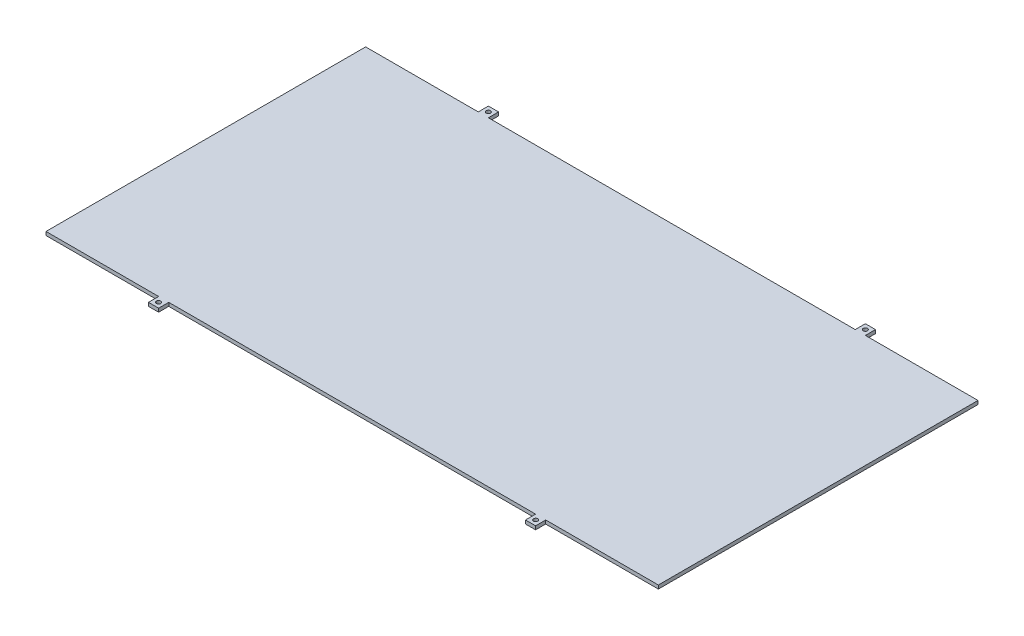
from build123d import *

# Parameters (mm, degrees)
SKETCH1_W           = 543.73
SKETCH1_H           = 3.175
BOSS_EXTRUDE1_DEPTH = 283.825
CUT_EXTRUDE1_DEPTH  = 1.3
SKETCH2_W           = 9
SKETCH2_H           = 9
SKETCH2_R           = 1.925
BOSS_EXTRUDE2_DEPTH = 3.125


with BuildPart() as part:
    # Sketch1 → Boss-Extrude1 (new body)
    with BuildSketch(Plane.XY):
        with Locations((-308.730031966, 1.266681686)):
            Rectangle(SKETCH1_W, SKETCH1_H)
    extrude(amount=BOSS_EXTRUDE1_DEPTH)

    # GasketGroove → Cut-Extrude1 (cut)
    with BuildSketch(Plane.XZ.offset(0.320818314)):
        with BuildLine():
            Line((-37.865031966, 2), (-37.865031966, 281.825))
            ThreePointArc((-37.865031966, 281.825), (-38.157925185, 282.532106781), (-38.865031966, 282.825))
            Line((-38.865031966, 282.825), (-578.595031966, 282.825))
            ThreePointArc((-578.595031966, 282.825), (-579.302138747, 282.532106781), (-579.595031966, 281.825))
            Line((-579.595031966, 281.825), (-579.595031966, 2))
            ThreePointArc((-579.595031966, 2), (-579.302138747, 1.292893219), (-578.595031966, 1))
            Line((-578.595031966, 1), (-38.865031966, 1))
            ThreePointArc((-38.865031966, 1), (-38.157925185, 1.292893219), (-37.865031966, 2))
        make_face()
        with BuildLine():
            Line((-577.595031966, 279.825), (-577.595031966, 4))
            ThreePointArc((-577.595031966, 4), (-577.302138747, 3.292893219), (-576.595031966, 3))
            Line((-576.595031966, 3), (-40.865031966, 3))
            ThreePointArc((-40.865031966, 3), (-40.157925185, 3.292893219), (-39.865031966, 4))
            Line((-39.865031966, 4), (-39.865031966, 279.825))
            ThreePointArc((-39.865031966, 279.825), (-40.157925185, 280.532106781), (-40.865031966, 280.825))
            Line((-40.865031966, 280.825), (-576.595031966, 280.825))
            ThreePointArc((-576.595031966, 280.825), (-577.302138747, 280.532106781), (-577.595031966, 279.825))
        make_face(mode=Mode.SUBTRACT)
    extrude(amount=-CUT_EXTRUDE1_DEPTH, mode=Mode.SUBTRACT)

    # Sketch2 → Boss-Extrude2 (add)
    # profile 1 of 4: a face of its own
    with BuildSketch(Plane(origin=(0, 2.854181686, 0), x_dir=(1, 0, 0), z_dir=(0, 1, 0))):
        with Locations((-476.095031966, -288.325)):
            Rectangle(SKETCH2_W, SKETCH2_H)
        with Locations((-476.095031966, -288.325)):
            Circle(SKETCH2_R, mode=Mode.SUBTRACT)
    # profile 2 of 4: a face of its own
    with BuildSketch(Plane(origin=(0, 2.854181686, 0), x_dir=(1, 0, 0), z_dir=(0, 1, 0))):
        with Locations((-141.365031966, -288.325)):
            Rectangle(SKETCH2_W, SKETCH2_H)
        with Locations((-141.365031966, -288.325)):
            Circle(SKETCH2_R, mode=Mode.SUBTRACT)
    # profile 3 of 4: a face of its own
    with BuildSketch(Plane(origin=(0, 2.854181686, 0), x_dir=(1, 0, 0), z_dir=(0, 1, 0))):
        with Locations((-141.365031966, 4.5)):
            Rectangle(SKETCH2_W, SKETCH2_H)
        with Locations((-141.365031966, 4.5)):
            Circle(SKETCH2_R, mode=Mode.SUBTRACT)
    # profile 4 of 4: a face of its own
    with BuildSketch(Plane(origin=(0, 2.854181686, 0), x_dir=(1, 0, 0), z_dir=(0, 1, 0))):
        with Locations((-476.095031966, 4.5)):
            Rectangle(SKETCH2_W, SKETCH2_H)
        with Locations((-476.095031966, 4.5)):
            Circle(SKETCH2_R, mode=Mode.SUBTRACT)
    extrude(amount=-BOSS_EXTRUDE2_DEPTH)


solid = part.part
